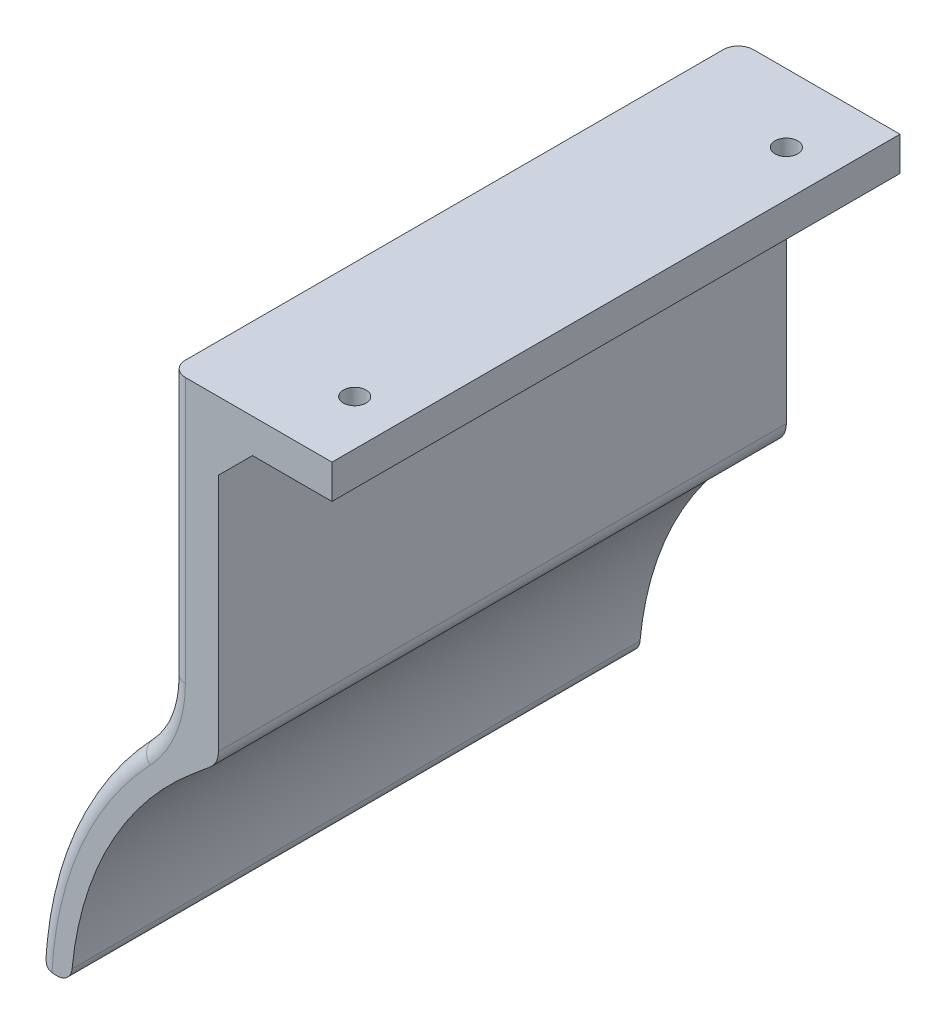
from build123d import *

# Parameters (mm, degrees)
EXTRUDE_1_DEPTH             = 25
EXTRUDE_3_DEPTH             = 25
CUT_EXTRUDE_1_DEPTH         = 53.179559149
CUT_EXTRUDE_1_DEPTH_BACK    = 53.179559149
SKETCH_4_W                  = 32
SKETCH_4_H                  = 14.912747354
FILLET_1_R                  = 10
FILLET_17_R                 = 2
CUT_EXTRUDE_5_DEPTH         = 60.625850278
CUT_EXTRUDE_5_DEPTH_BACK    = 60.625850278
CUT_EXTRUDE_6_DEPTH         = 60.600832153
CUT_EXTRUDE_6_DEPTH_BACK    = 60.600832153
SKETCH_9_W                  = 7
SKETCH_9_H                  = 3
SKETCH_10_W                 = 4.226496159
SKETCH_10_H                 = 9
EXTRUDE_4_DEPTH             = 10
SKETCH_12_W                 = 50
SKETCH_12_H                 = 3
EXTRUDE_6_DEPTH             = 10
EXTRUDE_6_DIRECTION_2_REACH = 62.659
SKETCH_14_R                 = 1
CUT_EXTRUDE_8_DEPTH         = 64.621818473
FILLET_50_R                 = 1.32
SKETCH_16_W                 = 32
SKETCH_16_H                 = 21.912747354
EXTRUDE_7_DEPTH             = 4.226496158
EXTRUDE_START               = 32
EXTRUDE_8_DEPTH             = 32
CHAMFER_1_SIZE              = 3


with BuildPart() as part:
    # 草图1 → 凸台-拉伸1 (new, symmetric)
    with BuildSketch(Plane.XY):
        with BuildLine():
            ThreePointArc((-33, 0), (-29.908156972, 13.946402637), (-21.21199112, 25.279466623))
            Line((-21.21199112, 25.279466623), (-16.985494961, 24.909696123))
            Line((-16.985494961, 24.909696123), (-19.283628291, 22.981333294))
            ThreePointArc((-19.283628291, 22.981333294), (-27.189233611, 12.678547852), (-30, 0))
            Line((-30, 0), (-33, 0))
        make_face()
    extrude(amount=EXTRUDE_1_DEPTH, both=True)

    # 草图1<7> → 凸台-拉伸3 (add, symmetric)
    with BuildSketch(Plane.XY):
        Polygon((-21.21199112, 25.279466623), (-21.21199112, 39.909696123), (-28.21199112, 39.909696123), (-28.21199112, 42.909696123), (-16.985494961, 42.909696123), (-16.985494961, 39.909696123), (-16.985494961, 24.909696123), align=None)
    extrude(amount=EXTRUDE_3_DEPTH, both=True)

    # 草图4 → 切除-拉伸1 (cut, two sides: drawn at the far end of the back side and taken through both)
    with BuildSketch(Plane(origin=(-16.985494961, 0, 0), x_dir=(0, 0, -1), z_dir=(1, 0, 0)).offset(-CUT_EXTRUDE_1_DEPTH_BACK)):
        with Locations((0, 35.453322446)):
            Rectangle(SKETCH_4_W, SKETCH_4_H)
    extrude(amount=CUT_EXTRUDE_1_DEPTH + CUT_EXTRUDE_1_DEPTH_BACK, mode=Mode.SUBTRACT)

    # 圆角1
    # the kernel refuses this fillet: 10 mm, written as the material it adds along each edge
    with BuildSketch(Plane(origin=(-21.21199112, 25.279466623, 25), x_dir=(-0.7281290100330119, -0.6854401102564294, 0), z_dir=(0, 0, -1))) as fillet_1_piece_1_section:
        with BuildLine():
            CenterArc((4.335441405, 9.983715921), FILLET_1_R, 223.270229162, 43.459541677)
            Line((-2.945848695, 3.129314818), (0, 0))
            ThreePointArc((0, 0), (1.882494294, 0.053737462), (3.764988589, 0))
        make_face()
    fillet_1_piece_1 = extrude(amount=50, mode=Mode.PRIVATE)
    fillet_1_piece_1 = split(fillet_1_piece_1, bisect_by=Plane(origin=(-21.85438977, 25.398045646, 16), z_dir=(0, 0, 1)), keep=Keep.TOP, mode=Mode.PRIVATE)
    fillet_1_piece_1 = split(fillet_1_piece_1, bisect_by=Plane(origin=(-21.85438977, 27.996948769, 20.5), z_dir=(0, -1, 0)), keep=Keep.TOP, mode=Mode.PRIVATE)
    add(fillet_1_piece_1)
    with BuildSketch(Plane(origin=(-21.21199112, 25.279466623, 25), x_dir=(-0.7281290100330119, -0.6854401102564294, 0), z_dir=(0, 0, -1))) as fillet_1_piece_2_section:
        with BuildLine():
            CenterArc((4.335441405, 9.983715921), FILLET_1_R, 223.270229162, 43.459541677)
            Line((-2.945848695, 3.129314818), (0, 0))
            ThreePointArc((0, 0), (1.882494294, 0.053737462), (3.764988589, 0))
        make_face()
    fillet_1_piece_2 = extrude(amount=50, mode=Mode.PRIVATE)
    fillet_1_piece_2 = split(fillet_1_piece_2, bisect_by=Plane(origin=(-21.135777092, 28.718730095, 16), z_dir=(0, 0, 1)), keep=Keep.TOP, mode=Mode.PRIVATE)
    fillet_1_piece_2 = split(fillet_1_piece_2, bisect_by=Plane(origin=(-21.135777092, 27.996948769, 20.5), z_dir=(0, 1, 0)), keep=Keep.TOP, mode=Mode.PRIVATE)
    add(fillet_1_piece_2)
    with BuildSketch(Plane(origin=(-21.21199112, 25.279466623, 25), x_dir=(-0.7281290100330119, -0.6854401102564294, 0), z_dir=(0, 0, -1))) as fillet_1_piece_3_section:
        with BuildLine():
            CenterArc((4.335441405, 9.983715921), FILLET_1_R, 223.270229162, 43.459541677)
            Line((-2.945848695, 3.129314818), (0, 0))
            ThreePointArc((0, 0), (1.882494294, 0.053737462), (3.764988589, 0))
        make_face()
    fillet_1_piece_3 = extrude(amount=50, mode=Mode.PRIVATE)
    fillet_1_piece_3 = split(fillet_1_piece_3, bisect_by=Plane(origin=(-21.85438977, 25.398045646, 16), z_dir=(0, 0, -1)), keep=Keep.TOP, mode=Mode.PRIVATE)
    fillet_1_piece_3 = split(fillet_1_piece_3, bisect_by=Plane(origin=(-21.85438977, 27.996948769, 0), z_dir=(0, -1, 0)), keep=Keep.TOP, mode=Mode.PRIVATE)
    fillet_1_piece_3 = split(fillet_1_piece_3, bisect_by=Plane(origin=(-21.85438977, 25.398045646, -16), z_dir=(0, 0, 1)), keep=Keep.TOP, mode=Mode.PRIVATE)
    add(fillet_1_piece_3)
    with BuildSketch(Plane(origin=(-21.21199112, 25.279466623, 25), x_dir=(-0.7281290100330119, -0.6854401102564294, 0), z_dir=(0, 0, -1))) as fillet_1_piece_4_section:
        with BuildLine():
            CenterArc((4.335441405, 9.983715921), FILLET_1_R, 223.270229162, 43.459541677)
            Line((-2.945848695, 3.129314818), (0, 0))
            ThreePointArc((0, 0), (1.882494294, 0.053737462), (3.764988589, 0))
        make_face()
    fillet_1_piece_4 = extrude(amount=50, mode=Mode.PRIVATE)
    fillet_1_piece_4 = split(fillet_1_piece_4, bisect_by=Plane(origin=(-21.85438977, 27.996948769, -20.5), z_dir=(0, -1, 0)), keep=Keep.TOP, mode=Mode.PRIVATE)
    fillet_1_piece_4 = split(fillet_1_piece_4, bisect_by=Plane(origin=(-21.85438977, 25.398045646, -16), z_dir=(0, 0, -1)), keep=Keep.TOP, mode=Mode.PRIVATE)
    add(fillet_1_piece_4)
    with BuildSketch(Plane(origin=(-21.21199112, 25.279466623, 25), x_dir=(-0.7281290100330119, -0.6854401102564294, 0), z_dir=(0, 0, -1))) as fillet_1_piece_5_section:
        with BuildLine():
            CenterArc((4.335441405, 9.983715921), FILLET_1_R, 223.270229162, 43.459541677)
            Line((-2.945848695, 3.129314818), (0, 0))
            ThreePointArc((0, 0), (1.882494294, 0.053737462), (3.764988589, 0))
        make_face()
    fillet_1_piece_5 = extrude(amount=50, mode=Mode.PRIVATE)
    fillet_1_piece_5 = split(fillet_1_piece_5, bisect_by=Plane(origin=(-21.135777092, 27.996948769, -20.5), z_dir=(0, 1, 0)), keep=Keep.TOP, mode=Mode.PRIVATE)
    fillet_1_piece_5 = split(fillet_1_piece_5, bisect_by=Plane(origin=(-21.135777092, 28.718730095, -16), z_dir=(0, 0, -1)), keep=Keep.TOP, mode=Mode.PRIVATE)
    add(fillet_1_piece_5)

    # 圆角17
    fillet_17_edges = [part.edges().sort_by_distance(p)[0] for p in [
        (-16.985494961, 24.909696123, 0),
    ]]
    fillet(fillet_17_edges, radius=FILLET_17_R)

    # 草图7 → 切除-拉伸5 (cut, two sides: drawn at the far end of the back side and taken through both)
    with BuildSketch(Plane.XY.offset(-CUT_EXTRUDE_5_DEPTH_BACK)):
        with BuildLine():
            Line((0, 0), (-33, 0))
            ThreePointArc((-33, 0), (-32.988691724, 0.863839294), (-32.954774647, 1.727086556))
            Line((-32.954774647, 1.727086556), (0, 0))
        make_face()
    extrude(amount=CUT_EXTRUDE_5_DEPTH + CUT_EXTRUDE_5_DEPTH_BACK, mode=Mode.SUBTRACT)

    # 草图9 → 切除-拉伸6 (cut, two sides: drawn at the far end of the back side and taken through both)
    with BuildSketch(Plane.XY.offset(-CUT_EXTRUDE_6_DEPTH_BACK)):
        with Locations((-24.71199112, 41.409696123)):
            Rectangle(SKETCH_9_W, SKETCH_9_H)
    extrude(amount=CUT_EXTRUDE_6_DEPTH + CUT_EXTRUDE_6_DEPTH_BACK, mode=Mode.SUBTRACT)

    # 草图10 → 凸台-拉伸4 (add)
    with BuildSketch(Plane(origin=(0, 42.909696123, 0), x_dir=(1, 0, 0), z_dir=(0, 1, 0))):
        with Locations((-19.098743041, 20.5)):
            Rectangle(SKETCH_10_W, SKETCH_10_H)
        with Locations((-19.098743041, -20.5)):
            Rectangle(SKETCH_10_W, SKETCH_10_H)
    extrude(amount=EXTRUDE_4_DEPTH)

    # 草图12 → 凸台-拉伸6 (add)
    with BuildSketch(Plane(origin=(-16.985494961, 0, 0), x_dir=(0, 0, -1), z_dir=(1, 0, 0))):
        with Locations((0, 51.409696123)):
            Rectangle(SKETCH_12_W, SKETCH_12_H)
    extrude(amount=EXTRUDE_6_DEPTH)

    # 凸台-拉伸6 direction 2: up to this face of the body (flat: up to its plane)
    extrude_6_direction_2_end = Plane(part.part.faces().sort_by_distance((-21.21199112, 41.24345525, 20.5))[0])
    # 草图12 → 凸台-拉伸6 direction 2 (add, up to the picked face)
    with BuildSketch(Plane(origin=(-16.985494961, 0, 0), x_dir=(0, 0, -1), z_dir=(1, 0, 0)), mode=Mode.PRIVATE) as extrude_6_direction_2_sk1:
        with Locations((0, 51.409696123)):
            Rectangle(SKETCH_12_W, SKETCH_12_H)
    extrude_6_direction_2_tool1 = split(extrude(extrude_6_direction_2_sk1.sketch, amount=-EXTRUDE_6_DIRECTION_2_REACH, mode=Mode.PRIVATE), bisect_by=extrude_6_direction_2_end, keep=Keep.BOTH, mode=Mode.PRIVATE)
    add(extrude_6_direction_2_tool1.solids().sort_by(Axis((-16.985495, 51.409696, 0), (-1, 0, 0)))[0])

    # 草图14 → 切除-拉伸8 (cut, through all)
    with BuildSketch(Plane(origin=(0, 49.909696123, 0), x_dir=(-1, 0, 0), z_dir=(0, -1, 0))):
        with Locations(Location((10.985494961, 19, 0), (0, 0, 180))):
            Circle(SKETCH_14_R)
        with Locations((10.985494961, -19)):
            Circle(SKETCH_14_R)
    extrude(amount=-CUT_EXTRUDE_8_DEPTH, mode=Mode.SUBTRACT)

    # 圆角50
    fillet_50_edges = [part.edges().sort_by_distance(p)[0] for p in [
        (-21.21199112, 41.24345525, -25),
        (-21.21199112, 41.24345525, 25),
        (-21.922587859, 25.874919539, -25),
        (-21.922587859, 25.874919539, 25),
        (-30.324707269, 13.015841465, -25),
        (-30.324707269, 13.015841465, 25),
        (-29.958886043, 1.570078687, 0),
        (-32.954774647, 1.727086556, 0),
    ]]
    fillet(fillet_50_edges, radius=FILLET_50_R)

    # 草图16 → 凸台-拉伸7 (add)
    with BuildSketch(Plane(origin=(-16.985494961, 0, 0), x_dir=(0, 0, -1), z_dir=(1, 0, 0))):
        with Locations((0, 38.953322446)):
            Rectangle(SKETCH_16_W, SKETCH_16_H)
    extrude(amount=-EXTRUDE_7_DEPTH)

    # 草图17 → 凸台-拉伸8 (add)
    with BuildSketch(Plane.XY.offset(-16).offset(EXTRUDE_START)):
        with BuildLine():
            Line((-21.337642503, 27.996948769), (-21.21199112, 27.996948769))
            Line((-21.21199112, 27.996948769), (-21.21199112, 29.577214378))
            ThreePointArc((-21.21199112, 29.577214378), (-21.243453459, 28.784587785), (-21.337642503, 27.996948769))
        make_face()
    extrude(amount=-EXTRUDE_8_DEPTH)

    # 倒角1
    chamfer_1_edges = [part.edges().sort_by_distance(p)[0] for p in [
        (-16.985494961, 49.909696123, 0),
    ]]
    chamfer(chamfer_1_edges, length=CHAMFER_1_SIZE)


solid = part.part
